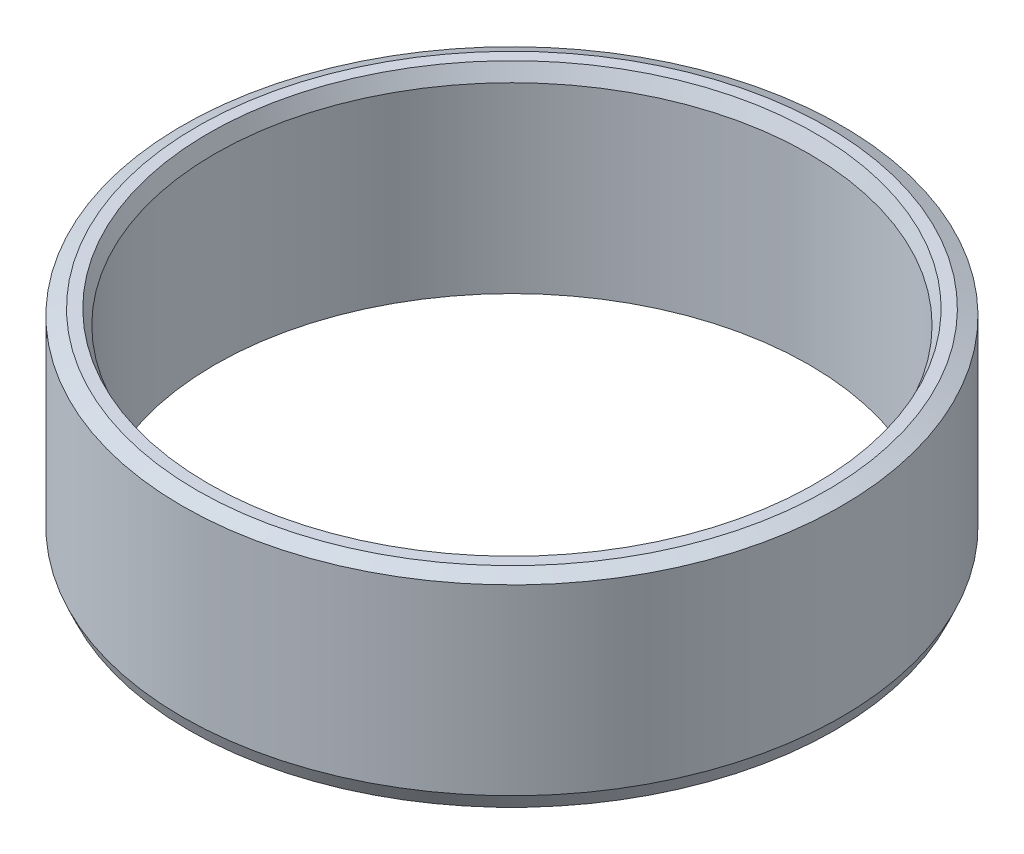
from build123d import *
from OCP.BRepFilletAPI import BRepFilletAPI_MakeChamfer

# Parameters (mm, degrees)
SKETCH1_R           = 47.5
BOSS_EXTRUDE1_DEPTH = 29.338004131
SKETCH2_R           = 42.821285845
CUT_EXTRUDE1_DEPTH  = 74.302240664
CHAMFER1_SIZE       = 0.917926737
CHAMFER1_SIZE2      = 2.100080646


with BuildPart() as part:
    # Sketch1 → Boss-Extrude1 (new body)
    with BuildSketch(Plane(origin=(0, 0, 0), x_dir=(1, 0, 0), z_dir=(0, 1, 0))):
        Circle(SKETCH1_R)
    extrude(amount=BOSS_EXTRUDE1_DEPTH)

    # Sketch2 → Cut-Extrude1 (cut, through all)
    with BuildSketch(Plane(origin=(0, 0, 0), x_dir=(1, 0, 0), z_dir=(0, 1, 0))):
        Circle(SKETCH2_R)
    extrude(amount=CUT_EXTRUDE1_DEPTH, mode=Mode.SUBTRACT)

    # Chamfer1: one chamfer whose edges measure the first distance from different faces: ONE call of the kernel's chamfer builder (chamfer() names one face for all edges)
    chamfer1_edges_1 = [part.edges().sort_by_distance(p)[0] for p in [
        (-42.821285845, 29.338004131, 0),
    ]]
    chamfer1_side_1 = [part.faces().sort_by_distance(p)[0] for p in [
        (-46.156497116, 29.338004131, 0),
    ]]
    chamfer1_edges_2 = [part.edges().sort_by_distance(p)[0] for p in [
        (-42.821285845, 0, 0),
    ]]
    chamfer1_side_2 = [part.faces().sort_by_distance(p)[0] for p in [
        (-42.821285845, 14.669002066, 0),
    ]]
    chamfer1_edges_3 = [part.edges().sort_by_distance(p)[0] for p in [
        (-47.5, 0, 0),
    ]]
    chamfer1_side_3 = [part.faces().sort_by_distance(p)[0] for p in [
        (-46.156497116, 0, 0),
    ]]
    chamfer1_edges_4 = [part.edges().sort_by_distance(p)[0] for p in [
        (-47.5, 29.338004131, 0),
    ]]
    chamfer1_side_4 = [part.faces().sort_by_distance(p)[0] for p in [
        (-47.5, 14.669002066, 0),
    ]]
    chamfer1 = BRepFilletAPI_MakeChamfer(part.part.solid().wrapped)
    for e in chamfer1_edges_1:
        chamfer1.Add(CHAMFER1_SIZE, CHAMFER1_SIZE2, e.wrapped, chamfer1_side_1[0].wrapped)  # the first distance lies on this face
    for e in chamfer1_edges_2:
        chamfer1.Add(CHAMFER1_SIZE, CHAMFER1_SIZE2, e.wrapped, chamfer1_side_2[0].wrapped)  # the first distance lies on this face
    for e in chamfer1_edges_3:
        chamfer1.Add(CHAMFER1_SIZE, CHAMFER1_SIZE2, e.wrapped, chamfer1_side_3[0].wrapped)  # the first distance lies on this face
    for e in chamfer1_edges_4:
        chamfer1.Add(CHAMFER1_SIZE, CHAMFER1_SIZE2, e.wrapped, chamfer1_side_4[0].wrapped)  # the first distance lies on this face
    add(Compound.cast(chamfer1.Shape()), mode=Mode.REPLACE)


solid = part.part
